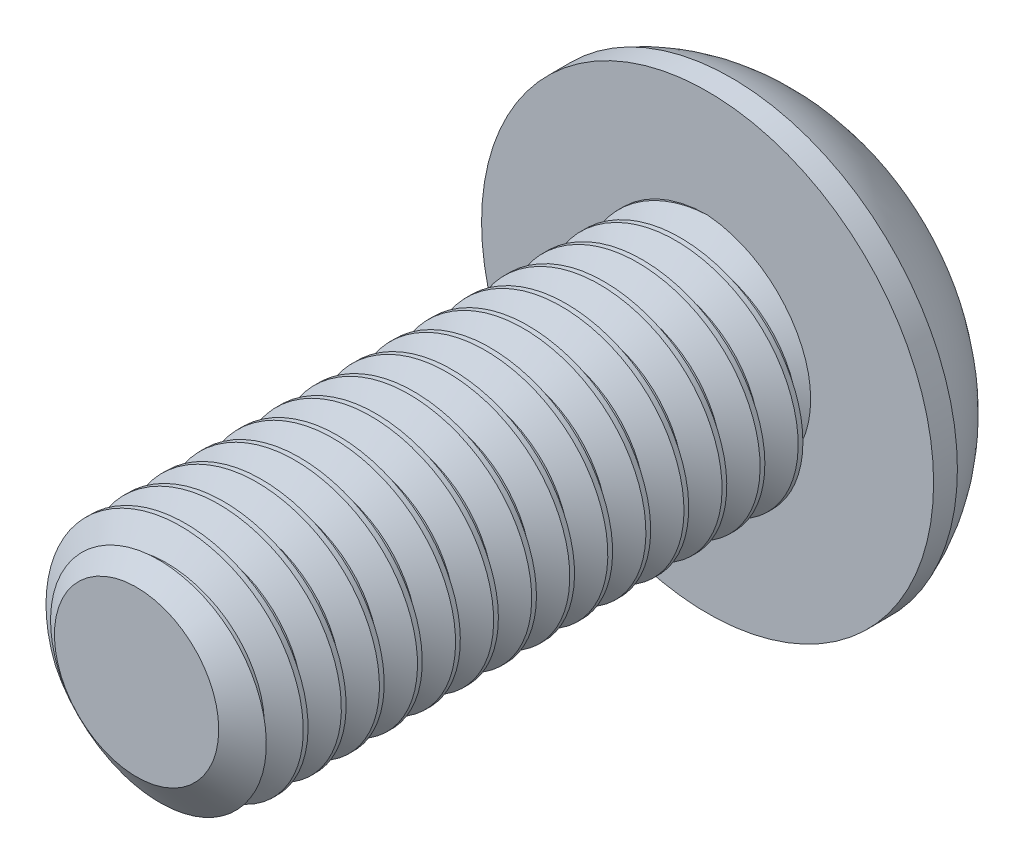
from build123d import *

# Parameters (mm, degrees)
SKETCH1_R          = 2.5
EXTRUDE1_DEPTH     = 12
CUT_SWEEP1_PITCH   = 0.7999999999999908
SKETCH6_R          = 4.75
EXTRUDE2_DEPTH     = 2.75
CUT_EXTRUDE1_DEPTH = 2.25
SKETCH8_R          = 1.7320508075688774
CUT_EXTRUDE2_DEPTH = 17.207637238351555
CUT_EXTRUDE2_TAPER = 45.0000000000001


with BuildPart() as part:
    # Sketch1 → Extrude1 (new body)
    with BuildSketch(Plane.XY):
        Circle(SKETCH1_R)
    extrude(amount=-EXTRUDE1_DEPTH)

    # Cut-Sweep1: the profile of Sketch3 profile screwed along a right-hand helix of 16 turns, 6 arcs to a turn; built about Z, then put on its axis
    cut_sweep1_z = Axis((0, 0, 0), (0, 0, 1))
    cut_sweep1_corners = [(2.5003, 0, -0.700173205), (1.980384758, 0, -0.4), (1.980384758, 0, -0.3), (2.5003, 0, 0.000173205)]
    with BuildLine(mode=Mode.PRIVATE) as cut_sweep1_profile:
        Line(cut_sweep1_corners[0], cut_sweep1_corners[1])
        Line(cut_sweep1_corners[1], cut_sweep1_corners[2])
        Line(cut_sweep1_corners[2], cut_sweep1_corners[3])
        Line(cut_sweep1_corners[3], cut_sweep1_corners[0])
    cut_sweep1_cap = Face(cut_sweep1_profile.wire())
    cut_sweep1_turn_angles = [0, 30, 60, 90, 120, 150, 180, 210, 240, 270, 300, 330, 360]
    cut_sweep1_turn_weights = [1, 0.8660254037844387, 1, 0.8660254037844387, 1, 0.8660254037844387, 1, 0.8660254037844387, 1, 0.8660254037844387, 1, 0.8660254037844387, 1]
    cut_sweep1_turn_rails = [Edge.make_bspline([Vector(p[0], p[1], 0).rotate(cut_sweep1_z, cut_sweep1_turn_angles[k]) / cut_sweep1_turn_weights[k] + Vector(0, 0, p[2] + CUT_SWEEP1_PITCH * cut_sweep1_turn_angles[k] / 360) for k in range(13)], [0, 0, 0, 1, 1, 2, 2, 3, 3, 4, 4, 5, 5, 6, 6, 6], 2, cut_sweep1_turn_weights) for p in cut_sweep1_corners]
    cut_sweep1_turn_sides = [Face.make_surface_from_curves(cut_sweep1_turn_rails[p[0]], cut_sweep1_turn_rails[p[1]]) for p in [(0, 1), (1, 2), (2, 3), (3, 0)]]
    cut_sweep1 = Plane(origin=(0, 0, 0), x_dir=(-3.49e-15, 1, 0), z_dir=(0, 0, -1)) * Solid(Shell([*[p.moved(Location((0, 0, CUT_SWEEP1_PITCH * i))) for i in range(16) for p in cut_sweep1_turn_sides], cut_sweep1_cap, cut_sweep1_cap.rotate(cut_sweep1_z, 5760).moved(Location((0, 0, CUT_SWEEP1_PITCH * 5760 / 360)))]))
    add(cut_sweep1, mode=Mode.SUBTRACT)

    # Sketch4 → Cut-Revolve1 (revolve, cut)
    with BuildSketch(Plane(origin=(0, 0, 0), x_dir=(0, 0, -1), z_dir=(1, 0, 0)), mode=Mode.PRIVATE) as cut_revolve1_sk:
        Polygon((0.5416912243118476, 2.5), (0, 1.7263847577293348), (0, 2.5), align=None)
    revolve(cut_revolve1_sk.sketch.rotate(Axis((0, 0, 0), (0, 0, -1)), 260.43858876), axis=Axis((0, 0, 0), (0, 0, -1)), mode=Mode.SUBTRACT)

    # Sketch6 → Extrude2 (add)
    with BuildSketch(Plane(origin=(0, 0, -12), x_dir=(-1, 0, 0), z_dir=(0, 0, -1))):
        Circle(SKETCH6_R)
    extrude(amount=EXTRUDE2_DEPTH)

    # Sketch10 → Cut-Revolve2 (revolve, cut)
    with BuildSketch(Plane(origin=(0, 0, 0), x_dir=(0, 0, -1), z_dir=(1, 0, 0)), mode=Mode.PRIVATE) as cut_revolve2_sk:
        with BuildLine():
            Line((12.5, 4.75), (12.500000000000004, 5.25))
            Line((12.500000000000004, 5.25), (15.25, 5.25))
            Line((15.25, 5.25), (15.25, 1.5000000000000004))
            Line((15.25, 1.5000000000000004), (14.75, 1.5000000000000004))
            ThreePointArc((14.75, 1.5000000000000004), (14.132611776540898, 3.4764235376052373), (12.5, 4.75))
        make_face()
    revolve(cut_revolve2_sk.sketch.rotate(Axis((0, 0, 0), (0, 0, -1)), 90), axis=Axis((0, 0, 0), (0, 0, -1)), mode=Mode.SUBTRACT)

    # Sketch7 → Cut-Extrude1 (cut)
    with BuildSketch(Plane(origin=(0, 0, -14.75), x_dir=(-1, 0, 0), z_dir=(0, 0, -1))):
        Polygon((-2.6e-16, 1.7320508075688774), (-1.5, 0.8660254037844389), (-1.5, -0.8660254037844387), (1e-16, -1.7320508075688774), (1.5000000000000009, -0.8660254037844387), (1.5000000000000002, 0.8660254037844387), align=None)
    extrude(amount=-CUT_EXTRUDE1_DEPTH, mode=Mode.SUBTRACT)

    # Sketch8 → Cut-Extrude2 (cut, through all)
    with BuildSketch(Plane.XY.offset(-14.75)):
        Circle(SKETCH8_R)
    extrude(amount=CUT_EXTRUDE2_DEPTH, taper=CUT_EXTRUDE2_TAPER, mode=Mode.SUBTRACT)


solid = part.part
